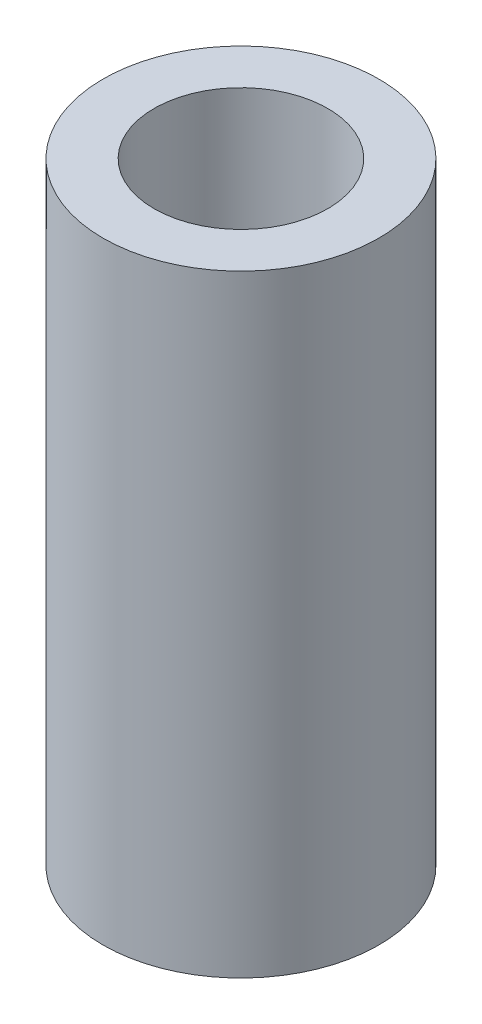
from build123d import *

# Parameters (mm, degrees)
SKETCH1_R           = 6.35
BOSS_EXTRUDE1_DEPTH = 28.194
SKETCH3_R           = 4
CUT_EXTRUDE2_DEPTH  = 30.589637308


with BuildPart() as part:
    # Sketch1 → Boss-Extrude1 (new body)
    with BuildSketch(Plane(origin=(0, 0, 0), x_dir=(1, 0, 0), z_dir=(0, 1, 0))):
        Circle(SKETCH1_R)
    extrude(amount=BOSS_EXTRUDE1_DEPTH)

    # Sketch3 → Cut-Extrude2 (cut, through all)
    with BuildSketch(Plane(origin=(0, 28.194, 0), x_dir=(1, 0, 0), z_dir=(0, 1, 0))):
        Circle(SKETCH3_R)
    extrude(amount=-CUT_EXTRUDE2_DEPTH, mode=Mode.SUBTRACT)


solid = part.part
